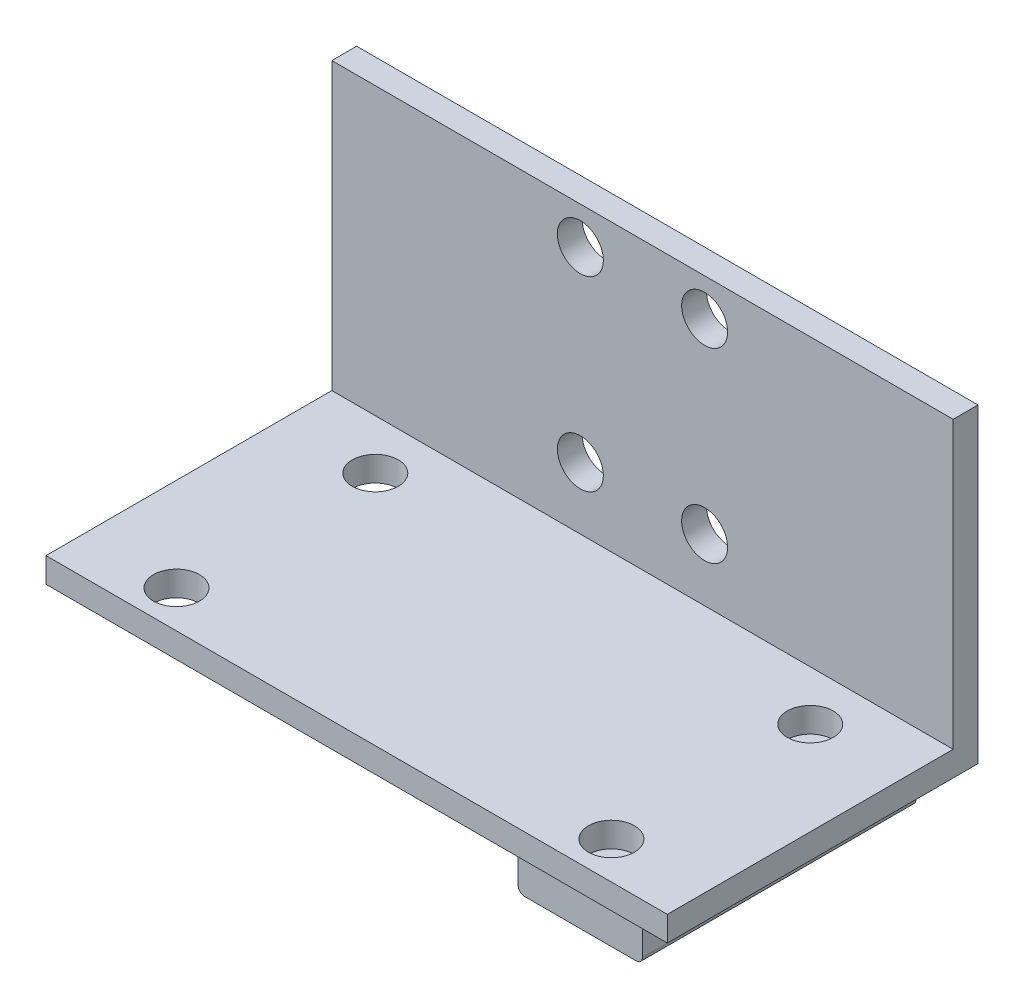
from build123d import *

# Parameters (mm, degrees)
SKETCH1_W           = 50
SKETCH1_H           = 25
BOSS_EXTRUDE1_DEPTH = 2
SKETCH3_W           = 50
SKETCH3_H           = 2
BOSS_EXTRUDE2_DEPTH = 23
SKETCH4_R           = 1.85
CUT_EXTRUDE1_DEPTH  = 23
SKETCH5_R           = 1.85
CUT_EXTRUDE2_DEPTH  = 23
SKETCH6_W           = 10
SKETCH6_H           = 22
BOSS_EXTRUDE3_DEPTH = 3
FILLET1_R           = 0.5


with BuildPart() as part:
    # Sketch1 → Boss-Extrude1 (new body)
    with BuildSketch(Plane(origin=(0, 0, 0), x_dir=(1, 0, 0), z_dir=(0, 1, 0))):
        with Locations((25, 12.5)):
            Rectangle(SKETCH1_W, SKETCH1_H)
    extrude(amount=BOSS_EXTRUDE1_DEPTH)

    # Sketch3 → Boss-Extrude2 (add)
    with BuildSketch(Plane(origin=(0, 2, 0), x_dir=(1, 0, 0), z_dir=(0, 1, 0))):
        with Locations((25, 24)):
            Rectangle(SKETCH3_W, SKETCH3_H)
    extrude(amount=BOSS_EXTRUDE2_DEPTH)

    # Sketch4 → Cut-Extrude1 (cut)
    with BuildSketch(Plane.XY.offset(-23)):
        with Locations((20, 22)):
            Circle(SKETCH4_R)
        with Locations((30, 22)):
            Circle(SKETCH4_R)
        with Locations((30, 7)):
            Circle(SKETCH4_R)
        with Locations((20, 7)):
            Circle(SKETCH4_R)
    extrude(amount=-CUT_EXTRUDE1_DEPTH, mode=Mode.SUBTRACT)

    # Sketch5 → Cut-Extrude2 (cut)
    with BuildSketch(Plane(origin=(0, 2, 0), x_dir=(1, 0, 0), z_dir=(0, 1, 0))):
        with Locations((7.5, 3)):
            Circle(SKETCH5_R)
        with Locations((7.5, 19)):
            Circle(SKETCH5_R)
        with Locations((42.5, 3)):
            Circle(SKETCH5_R)
        with Locations((42.5, 19)):
            Circle(SKETCH5_R)
    extrude(amount=-CUT_EXTRUDE2_DEPTH, mode=Mode.SUBTRACT)

    # Sketch6 → Boss-Extrude3 (add)
    with BuildSketch(Plane.XZ):
        with Locations((42.5, -11.5)):
            Rectangle(SKETCH6_W, SKETCH6_H)
    extrude(amount=BOSS_EXTRUDE3_DEPTH)

    # Fillet1
    fillet1_edges = [part.edges().sort_by_distance(p)[0] for p in [
        (47.5, -3, -11.5),
        (37.5, -3, -11.5),
    ]]
    fillet(fillet1_edges, radius=FILLET1_R)


solid = part.part
